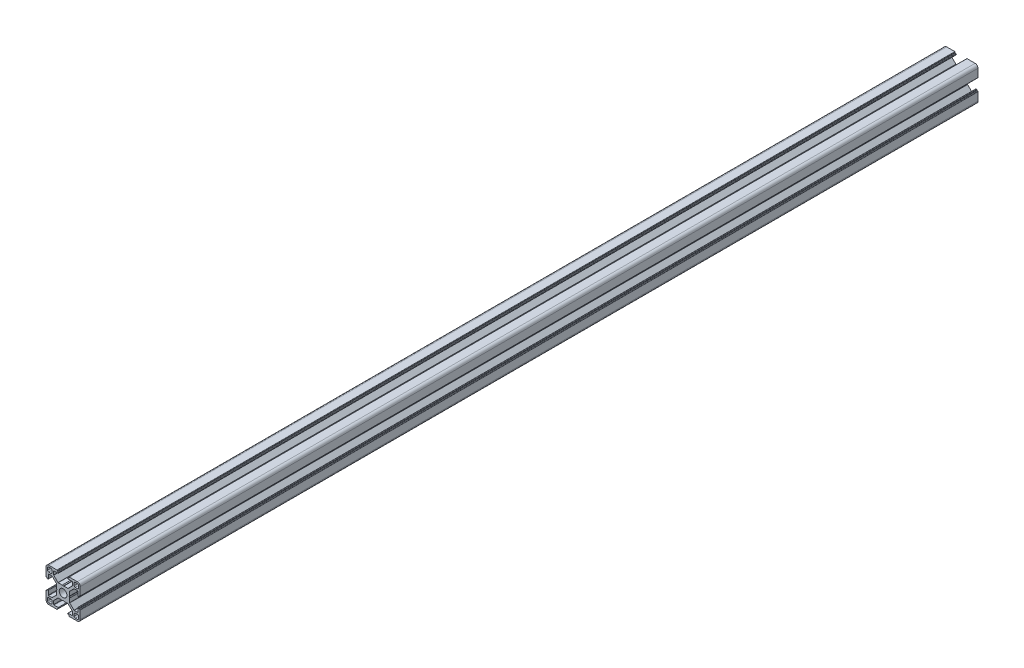
from build123d import *

# Parameters (mm, degrees)
EXTRUSION1_OUTLINE_R = 3.4
EXTRUSION1_DEPTH     = 789
CUT_EXTRUDE1_REACH   = 791.478
SKETCH1_R            = 1.5


# Read off the part's stored shape, not the designer's step: Extrusion1
with BuildPart() as part:
    # Extrusion1 outline → Extrusion1 (new body)
    with BuildSketch(Plane.XY):
        with BuildLine():
            Line((8.185538534, -2.843701547), (11.697060903, -2.843701547))
            add(Edge.make_bspline(
                [(11.697060903, -2.843701547), (11.821324972, -2.843701547), (11.909192937, -2.931569512)],
                knots=[1.178097245, 1.178097245, 1.178097245, 1.963495408, 1.963495408, 1.963495408], degree=2, weights=[1, 0.923879533, 1]))
            Line((11.909192937, -2.931569512), (15.597670569, -6.620047143))
            ThreePointArc((15.597670569, -6.620047143), (15.662702394, -6.717374148), (15.685538534, -6.832179178))
            Line((15.685538534, -6.832179178), (15.685538534, -9.743701547))
            ThreePointArc((15.685538534, -9.743701547), (15.597670568, -9.955833582), (15.385538534, -10.043701547))
            Line((15.385538534, -10.043701547), (11.835538534, -10.043701547))
            add(Edge.make_bspline(
                [(11.835538534, -10.043701547), (11.535538534, -10.043701547), (11.535538534, -10.343701547)],
                knots=[3.926990817, 3.926990817, 3.926990817, 5.497787144, 5.497787144, 5.497787144], degree=2, weights=[1, 0.707106781, 1]))
            Line((11.535538534, -10.343701547), (11.535538534, -10.743701547))
            add(Edge.make_bspline(
                [(11.535538534, -10.743701547), (11.535538534, -11.043701547), (11.835538534, -11.043701547)],
                knots=[3.926990817, 3.926990817, 3.926990817, 5.497787144, 5.497787144, 5.497787144], degree=2, weights=[1, 0.707106781, 1]))
            Line((11.835538534, -11.043701547), (12.235538534, -11.043701547))
            ThreePointArc((12.235538534, -11.043701547), (12.447670568, -11.131569513), (12.535538534, -11.343701547))
            Line((12.535538534, -11.343701547), (12.535538534, -11.743701547))
            ThreePointArc((12.535538534, -11.743701547), (12.6234065, -11.955833581), (12.835538534, -12.043701547))
            Line((12.835538534, -12.043701547), (19.935538534, -12.043701547))
            ThreePointArc((19.935538534, -12.043701547), (21.703305487, -11.3114685), (22.435538534, -9.543701546))
            Line((22.435538534, -9.543701546), (22.435538534, -2.443701547))
            ThreePointArc((22.435538534, -2.443701547), (22.347670569, -2.231569512), (22.135538534, -2.143701547))
            Line((22.135538534, -2.143701547), (21.735538534, -2.143701547))
            ThreePointArc((21.735538534, -2.143701547), (21.5234065, -2.055833581), (21.435538534, -1.843701546))
            Line((21.435538534, -1.843701546), (21.435538534, -1.443701547))
            ThreePointArc((21.435538534, -1.443701547), (21.347670569, -1.231569512), (21.135538534, -1.143701547))
            Line((21.135538534, -1.143701547), (20.735538534, -1.143701547))
            ThreePointArc((20.735538534, -1.143701547), (20.523406499, -1.231569513), (20.435538534, -1.443701547))
            Line((20.435538534, -1.443701547), (20.435538534, -4.993701547))
            ThreePointArc((20.435538534, -4.993701547), (20.347670568, -5.205833582), (20.135538534, -5.293701547))
            Line((20.135538534, -5.293701547), (17.224016165, -5.293701547))
            ThreePointArc((17.224016165, -5.293701547), (17.109211136, -5.270865406), (17.011884131, -5.205833581))
            Line((17.011884131, -5.205833581), (13.3234065, -1.51735595))
            ThreePointArc((13.3234065, -1.51735595), (13.258374674, -1.420028946), (13.235538534, -1.305223916))
            Line((13.235538534, -1.305223916), (13.235538534, 2.206298453))
            Line((13.235538534, 2.206298453), (12.802525832, 2.956298453))
            Line((12.802525832, 2.956298453), (13.235538534, 3.706298453))
            Line((13.235538534, 3.706298453), (13.235538534, 7.217820822))
            ThreePointArc((13.235538534, 7.217820822), (13.258374674, 7.332625852), (13.3234065, 7.429952857))
            Line((13.3234065, 7.429952857), (17.011884131, 11.118430488))
            add(Edge.make_bspline(
                [(17.011884131, 11.118430488), (17.099752097, 11.206298453), (17.224016165, 11.206298453)],
                knots=[5.890486225, 5.890486225, 5.890486225, 6.675884389, 6.675884389, 6.675884389], degree=2, weights=[1, 0.923879533, 1]))
            Line((17.224016165, 11.206298453), (20.135538534, 11.206298453))
            add(Edge.make_bspline(
                [(20.135538534, 11.206298453), (20.435538534, 11.206298453), (20.435538534, 10.906298453)],
                knots=[0.785398163, 0.785398163, 0.785398163, 2.35619449, 2.35619449, 2.35619449], degree=2, weights=[1, 0.707106781, 1]))
            Line((20.435538534, 10.906298453), (20.435538534, 7.356298453))
            ThreePointArc((20.435538534, 7.356298453), (20.5234065, 7.144166419), (20.735538534, 7.056298453))
            Line((20.735538534, 7.056298453), (21.135538534, 7.056298453))
            add(Edge.make_bspline(
                [(21.135538534, 7.056298453), (21.435538534, 7.056298453), (21.435538534, 7.356298453)],
                knots=[5.497787144, 5.497787144, 5.497787144, 7.068583471, 7.068583471, 7.068583471], degree=2, weights=[1, 0.707106781, 1]))
            Line((21.435538534, 7.356298453), (21.435538534, 7.756298453))
            ThreePointArc((21.435538534, 7.756298453), (21.5234065, 7.968430488), (21.735538534, 8.056298453))
            Line((21.735538534, 8.056298453), (22.135538534, 8.056298453))
            add(Edge.make_bspline(
                [(22.135538534, 8.056298453), (22.435538534, 8.056298453), (22.435538534, 8.356298453)],
                knots=[3.926990817, 3.926990817, 3.926990817, 5.497787144, 5.497787144, 5.497787144], degree=2, weights=[1, 0.707106781, 1]))
            Line((22.435538534, 8.356298453), (22.435538534, 15.456298453))
            ThreePointArc((22.435538534, 15.456298453), (21.703305487, 17.224065406), (19.935538534, 17.956298453))
            Line((19.935538534, 17.956298453), (12.835538534, 17.956298453))
            ThreePointArc((12.835538534, 17.956298453), (12.6234065, 17.868430488), (12.535538534, 17.656298454))
            Line((12.535538534, 17.656298454), (12.535538534, 17.256298454))
            ThreePointArc((12.535538534, 17.256298454), (12.447670568, 17.044166419), (12.235538534, 16.956298453))
            Line((12.235538534, 16.956298453), (11.835538534, 16.956298453))
            add(Edge.make_bspline(
                [(11.835538534, 16.956298453), (11.535538534, 16.956298453), (11.535538534, 16.656298453)],
                knots=[3.926990817, 3.926990817, 3.926990817, 5.497787144, 5.497787144, 5.497787144], degree=2, weights=[1, 0.707106781, 1]))
            Line((11.535538534, 16.656298453), (11.535538534, 16.256298453))
            ThreePointArc((11.535538534, 16.256298453), (11.6234065, 16.044166419), (11.835538534, 15.956298453))
            Line((11.835538534, 15.956298453), (15.385538534, 15.956298453))
            add(Edge.make_bspline(
                [(15.385538534, 15.956298453), (15.685538534, 15.956298453), (15.685538534, 15.656298453)],
                knots=[0.785398163, 0.785398163, 0.785398163, 2.35619449, 2.35619449, 2.35619449], degree=2, weights=[1, 0.707106781, 1]))
            Line((15.685538534, 15.656298453), (15.685538534, 12.744776084))
            add(Edge.make_bspline(
                [(15.685538534, 12.744776084), (15.685538534, 12.620512016), (15.597670569, 12.53264405)],
                knots=[1.178097245, 1.178097245, 1.178097245, 1.963495408, 1.963495408, 1.963495408], degree=2, weights=[1, 0.923879533, 1]))
            Line((15.597670569, 12.53264405), (11.909192937, 8.844166419))
            ThreePointArc((11.909192937, 8.844166419), (11.811865932, 8.779134594), (11.697060903, 8.756298453))
            Line((11.697060903, 8.756298453), (8.185538534, 8.756298453))
            Line((8.185538534, 8.756298453), (7.435538534, 8.323285751))
            Line((7.435538534, 8.323285751), (6.685538534, 8.756298453))
            Line((6.685538534, 8.756298453), (3.174016165, 8.756298453))
            ThreePointArc((3.174016165, 8.756298453), (3.059211136, 8.779134594), (2.961884131, 8.844166419))
            Line((2.961884131, 8.844166419), (-0.7265935, 12.53264405))
            ThreePointArc((-0.7265935, 12.53264405), (-0.791625326, 12.629971054), (-0.814461466, 12.744776084))
            Line((-0.814461466, 12.744776084), (-0.814461466, 15.656298453))
            add(Edge.make_bspline(
                [(-0.814461466, 15.656298453), (-0.814461466, 15.956298453), (-0.514461466, 15.956298453)],
                knots=[5.497787144, 5.497787144, 5.497787144, 7.068583471, 7.068583471, 7.068583471], degree=2, weights=[1, 0.707106781, 1]))
            Line((-0.514461466, 15.956298453), (3.035538534, 15.956298453))
            ThreePointArc((3.035538534, 15.956298453), (3.247670568, 16.044166418), (3.335538534, 16.256298453))
            Line((3.335538534, 16.256298453), (3.335538534, 16.656298453))
            add(Edge.make_bspline(
                [(3.335538534, 16.656298453), (3.335538534, 16.956298453), (3.035538534, 16.956298453)],
                knots=[3.926990817, 3.926990817, 3.926990817, 5.497787144, 5.497787144, 5.497787144], degree=2, weights=[1, 0.707106781, 1]))
            Line((3.035538534, 16.956298453), (2.635538534, 16.956298453))
            add(Edge.make_bspline(
                [(2.635538534, 16.956298453), (2.335538534, 16.956298453), (2.335538534, 17.256298454)],
                knots=[2.35619449, 2.35619449, 2.35619449, 3.926990817, 3.926990817, 3.926990817], degree=2, weights=[1, 0.707106781, 1]))
            Line((2.335538534, 17.256298454), (2.335538534, 17.656298454))
            ThreePointArc((2.335538534, 17.656298454), (2.247670569, 17.868430488), (2.035538534, 17.956298453))
            Line((2.035538534, 17.956298453), (-5.064461466, 17.956298453))
            ThreePointArc((-5.064461466, 17.956298453), (-6.832228419, 17.224065406), (-7.564461466, 15.456298453))
            Line((-7.564461466, 15.456298453), (-7.564461466, 8.356298453))
            ThreePointArc((-7.564461466, 8.356298453), (-7.4765935, 8.144166419), (-7.264461466, 8.056298453))
            Line((-7.264461466, 8.056298453), (-6.864461466, 8.056298453))
            ThreePointArc((-6.864461466, 8.056298453), (-6.652329432, 7.968430488), (-6.564461466, 7.756298453))
            Line((-6.564461466, 7.756298453), (-6.564461466, 7.356298453))
            add(Edge.make_bspline(
                [(-6.564461466, 7.356298453), (-6.564461466, 7.056298453), (-6.264461466, 7.056298453)],
                knots=[5.497787144, 5.497787144, 5.497787144, 7.068583471, 7.068583471, 7.068583471], degree=2, weights=[1, 0.707106781, 1]))
            Line((-6.264461466, 7.056298453), (-5.864461466, 7.056298453))
            add(Edge.make_bspline(
                [(-5.864461466, 7.056298453), (-5.564461466, 7.056298453), (-5.564461466, 7.356298453)],
                knots=[5.497787144, 5.497787144, 5.497787144, 7.068583471, 7.068583471, 7.068583471], degree=2, weights=[1, 0.707106781, 1]))
            Line((-5.564461466, 7.356298453), (-5.564461466, 10.906298453))
            add(Edge.make_bspline(
                [(-5.564461466, 10.906298453), (-5.564461466, 11.206298453), (-5.264461466, 11.206298453)],
                knots=[0.785398163, 0.785398163, 0.785398163, 2.35619449, 2.35619449, 2.35619449], degree=2, weights=[1, 0.707106781, 1]))
            Line((-5.264461466, 11.206298453), (-2.352939097, 11.206298453))
            ThreePointArc((-2.352939097, 11.206298453), (-2.238134067, 11.183462313), (-2.140807063, 11.118430488))
            Line((-2.140807063, 11.118430488), (1.547670569, 7.429952857))
            ThreePointArc((1.547670569, 7.429952857), (1.612702394, 7.332625852), (1.635538534, 7.217820822))
            Line((1.635538534, 7.217820822), (1.635538534, 3.706298453))
            Line((1.635538534, 3.706298453), (2.068551236, 2.956298453))
            Line((2.068551236, 2.956298453), (1.635538534, 2.206298453))
            Line((1.635538534, 2.206298453), (1.635538534, -1.305223916))
            ThreePointArc((1.635538534, -1.305223916), (1.612702394, -1.420028945), (1.547670569, -1.51735595))
            Line((1.547670569, -1.51735595), (-2.140807063, -5.205833581))
            ThreePointArc((-2.140807063, -5.205833581), (-2.238134068, -5.270865406), (-2.352939097, -5.293701547))
            Line((-2.352939097, -5.293701547), (-5.264461466, -5.293701547))
            ThreePointArc((-5.264461466, -5.293701547), (-5.4765935, -5.205833581), (-5.564461466, -4.993701547))
            Line((-5.564461466, -4.993701547), (-5.564461466, -1.443701547))
            add(Edge.make_bspline(
                [(-5.564461466, -1.443701547), (-5.564461466, -1.143701547), (-5.864461466, -1.143701547)],
                knots=[5.497787144, 5.497787144, 5.497787144, 7.068583471, 7.068583471, 7.068583471], degree=2, weights=[1, 0.707106781, 1]))
            Line((-5.864461466, -1.143701547), (-6.264461466, -1.143701547))
            add(Edge.make_bspline(
                [(-6.264461466, -1.143701547), (-6.564461466, -1.143701547), (-6.564461466, -1.443701547)],
                knots=[5.497787144, 5.497787144, 5.497787144, 7.068583471, 7.068583471, 7.068583471], degree=2, weights=[1, 0.707106781, 1]))
            Line((-6.564461466, -1.443701547), (-6.564461466, -1.843701546))
            ThreePointArc((-6.564461466, -1.843701546), (-6.652329432, -2.055833581), (-6.864461466, -2.143701547))
            Line((-6.864461466, -2.143701547), (-7.264461466, -2.143701547))
            ThreePointArc((-7.264461466, -2.143701547), (-7.4765935, -2.231569512), (-7.564461466, -2.443701546))
            Line((-7.564461466, -2.443701546), (-7.564461466, -9.543701546))
            ThreePointArc((-7.564461466, -9.543701546), (-6.832228419, -11.3114685), (-5.064461466, -12.043701547))
            Line((-5.064461466, -12.043701547), (2.035538534, -12.043701547))
            ThreePointArc((2.035538534, -12.043701547), (2.247670569, -11.955833582), (2.335538534, -11.743701547))
            Line((2.335538534, -11.743701547), (2.335538534, -11.343701547))
            ThreePointArc((2.335538534, -11.343701547), (2.4234065, -11.131569513), (2.635538534, -11.043701547))
            Line((2.635538534, -11.043701547), (3.035538534, -11.043701547))
            add(Edge.make_bspline(
                [(3.035538534, -11.043701547), (3.335538534, -11.043701547), (3.335538534, -10.743701547)],
                knots=[3.926990817, 3.926990817, 3.926990817, 5.497787144, 5.497787144, 5.497787144], degree=2, weights=[1, 0.707106781, 1]))
            Line((3.335538534, -10.743701547), (3.335538534, -10.343701547))
            add(Edge.make_bspline(
                [(3.335538534, -10.343701547), (3.335538534, -10.043701547), (3.035538534, -10.043701547)],
                knots=[3.926990817, 3.926990817, 3.926990817, 5.497787144, 5.497787144, 5.497787144], degree=2, weights=[1, 0.707106781, 1]))
            Line((3.035538534, -10.043701547), (-0.514461466, -10.043701547))
            ThreePointArc((-0.514461466, -10.043701547), (-0.7265935, -9.955833581), (-0.814461466, -9.743701547))
            Line((-0.814461466, -9.743701547), (-0.814461466, -6.832179178))
            ThreePointArc((-0.814461466, -6.832179178), (-0.791625326, -6.717374148), (-0.7265935, -6.620047143))
            Line((-0.7265935, -6.620047143), (2.961884131, -2.931569512))
            ThreePointArc((2.961884131, -2.931569512), (3.059211136, -2.866537687), (3.174016165, -2.843701547))
            Line((3.174016165, -2.843701547), (6.685538534, -2.843701547))
            Line((6.685538534, -2.843701547), (7.435538534, -2.410688845))
            Line((7.435538534, -2.410688845), (8.185538534, -2.843701547))
        make_face()
        with BuildLine():
            Line((-3.314461466, -10.693701547), (-5.214461466, -10.693701547))
            ThreePointArc((-5.214461466, -10.693701547), (-5.921568247, -10.400808328), (-6.214461466, -9.693701547))
            Line((-6.214461466, -9.693701547), (-6.214461466, -7.793701547))
            ThreePointArc((-6.214461466, -7.793701547), (-5.921568247, -7.086594766), (-5.214461466, -6.793701547))
            Line((-5.214461466, -6.793701547), (-3.314461466, -6.793701547))
            ThreePointArc((-3.314461466, -6.793701547), (-2.607354684, -7.086594766), (-2.314461466, -7.793701547))
            Line((-2.314461466, -7.793701547), (-2.314461466, -9.693701547))
            ThreePointArc((-2.314461466, -9.693701547), (-2.607354685, -10.400808328), (-3.314461466, -10.693701547))
        make_face(mode=Mode.SUBTRACT)
        with Locations((7.435538534, 2.956298453)):
            Circle(EXTRUSION1_OUTLINE_R, mode=Mode.SUBTRACT)
        with BuildLine():
            Line((17.185538534, -9.693701547), (17.185538534, -7.793701547))
            ThreePointArc((17.185538534, -7.793701547), (17.478431753, -7.086594766), (18.185538534, -6.793701547))
            Line((18.185538534, -6.793701547), (20.085538534, -6.793701547))
            ThreePointArc((20.085538534, -6.793701547), (20.792645315, -7.086594766), (21.085538534, -7.793701547))
            Line((21.085538534, -7.793701547), (21.085538534, -9.693701547))
            ThreePointArc((21.085538534, -9.693701547), (20.792645315, -10.400808328), (20.085538534, -10.693701547))
            Line((20.085538534, -10.693701547), (18.185538534, -10.693701547))
            ThreePointArc((18.185538534, -10.693701547), (17.478431753, -10.400808328), (17.185538534, -9.693701547))
        make_face(mode=Mode.SUBTRACT)
        with BuildLine():
            Line((-6.214461466, 13.706298453), (-6.214461466, 15.606298453))
            ThreePointArc((-6.214461466, 15.606298453), (-5.921568248, 16.313405234), (-5.214461466, 16.606298453))
            Line((-5.214461466, 16.606298453), (-3.314461466, 16.606298453))
            ThreePointArc((-3.314461466, 16.606298453), (-2.607354684, 16.313405234), (-2.314461466, 15.606298453))
            Line((-2.314461466, 15.606298453), (-2.314461466, 13.706298453))
            ThreePointArc((-2.314461466, 13.706298453), (-2.607354685, 12.999191672), (-3.314461466, 12.706298453))
            Line((-3.314461466, 12.706298453), (-5.214461466, 12.706298453))
            ThreePointArc((-5.214461466, 12.706298453), (-5.921568247, 12.999191672), (-6.214461466, 13.706298453))
        make_face(mode=Mode.SUBTRACT)
        with BuildLine():
            Line((18.185538534, 16.606298453), (20.085538534, 16.606298453))
            ThreePointArc((20.085538534, 16.606298453), (20.792645315, 16.313405235), (21.085538534, 15.606298453))
            Line((21.085538534, 15.606298453), (21.085538534, 13.706298453))
            ThreePointArc((21.085538534, 13.706298453), (20.792645315, 12.999191672), (20.085538534, 12.706298453))
            Line((20.085538534, 12.706298453), (18.185538534, 12.706298453))
            ThreePointArc((18.185538534, 12.706298453), (17.478431753, 12.999191672), (17.185538534, 13.706298453))
            Line((17.185538534, 13.706298453), (17.185538534, 15.606298453))
            ThreePointArc((17.185538534, 15.606298453), (17.478431753, 16.313405234), (18.185538534, 16.606298453))
        make_face(mode=Mode.SUBTRACT)
    extrude(amount=EXTRUSION1_DEPTH)

    # Cut-Extrude1: up to this face of the body (flat: up to its plane)
    cut_extrude1_end = Plane(part.part.faces().sort_by_distance((-7.564461466, 11.906298453, 394.5))[0])
    # Sketch1 → Cut-Extrude1 (cut, up to the picked face)
    with BuildSketch(Plane(origin=(13.235538534, 0, 0), x_dir=(0, 0, -1), z_dir=(1, 0, 0)), mode=Mode.PRIVATE) as cut_extrude1_sk1:
        with Locations((-714, 2.956298453)):
            Circle(SKETCH1_R)
    cut_extrude1_tool1 = split(extrude(cut_extrude1_sk1.sketch, amount=-CUT_EXTRUDE1_REACH, mode=Mode.PRIVATE), bisect_by=cut_extrude1_end, keep=Keep.BOTH, mode=Mode.PRIVATE)
    add(cut_extrude1_tool1.solids().sort_by(Axis((13.235539, 2.956298, 714), (-1, 0, 0)))[0], mode=Mode.SUBTRACT)


solid = part.part
